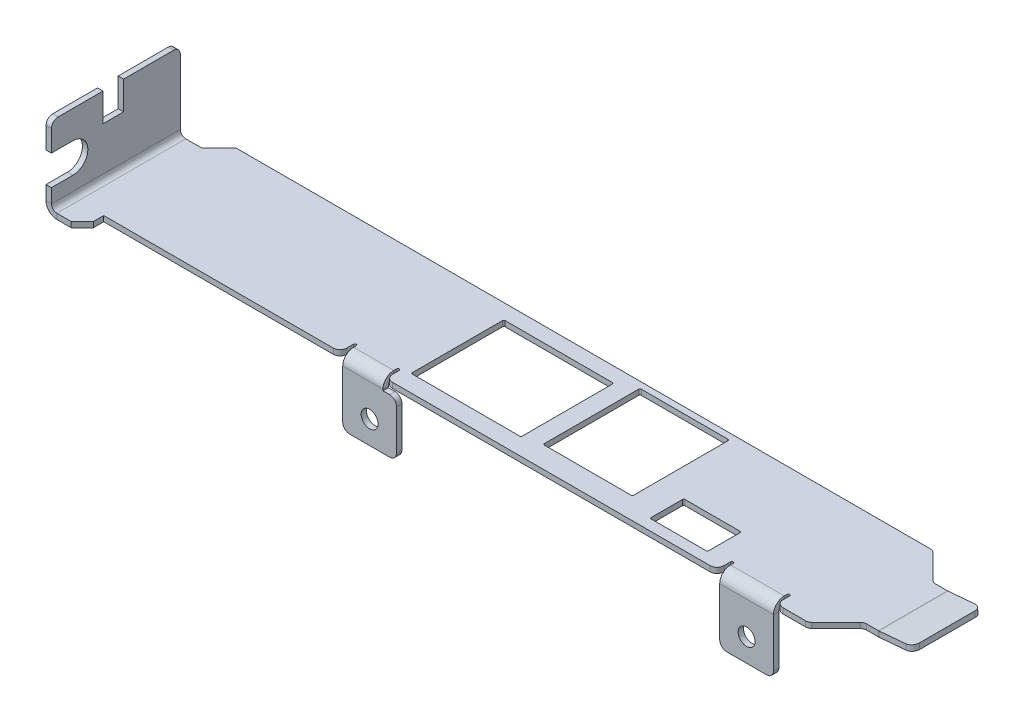
from build123d import *

# Parameters (mm, degrees)
SM_BASE_FLANGE_1_DEPTH           = 0.8
SKETCH_25_W                      = 16.240000001
SKETCH_25_H                      = 13.699999542
SKETCH_25_W_2                    = 13.2
SKETCH_25_H_2                    = 14.319999239
SKETCH_25_W_3                    = 8.5
SKETCH_25_H_3                    = 5
CUT_EXTRUDE_1_DEPTH              = 62.484573675
SM_EDGE_FLANGE_1_STRIP_CUT_DEPTH = 10.2
SM_EDGE_FLANGE_1_DEPTH           = 10.2
SM_START                         = -0.8
SM_EDGE_FLANGE_2_DEPTH           = 2.8
SM_START_2                       = 0.715504
SM_EDGE_FLANGE_2_2_OUTLINE_W     = 7.94
SM_EDGE_FLANGE_2_2_OUTLINE_H     = 0.8
SM_EDGE_FLANGE_2_2_DEPTH         = 1.284496
SM_START_3                       = -4.3519999
SM_EDGE_FLANGE_2_3_OUTLINE_W     = 7.94
SM_EDGE_FLANGE_2_3_OUTLINE_H     = 0.8
SM_EDGE_FLANGE_2_3_DEPTH         = 3.5519999
SM_START_4                       = -9
SM_EDGE_FLANGE_2_4_OUTLINE_W     = 7.94
SM_EDGE_FLANGE_2_4_OUTLINE_H     = 0.8
SM_EDGE_FLANGE_2_4_DEPTH         = 2.1479999
SM_START_5                       = 40.85
SM_EDGE_FLANGE_2_5_DEPTH         = 7.94
SM_EDGE_FLANGE_2_6_OUTLINE_W     = 2.5000002
SM_EDGE_FLANGE_2_6_OUTLINE_H     = 0.8
SM_EDGE_FLANGE_2_6_DEPTH         = 2.7199999
SM_START_6                       = 46.0700001
SM_EDGE_FLANGE_2_7_OUTLINE_W     = 2.5000002
SM_EDGE_FLANGE_2_7_OUTLINE_H     = 0.8
SM_EDGE_FLANGE_2_7_DEPTH         = 2.7199999
SM_START_7                       = 41.6657556
SM_EDGE_FLANGE_2_8_DEPTH         = 6.2856216
SM_START_8                       = 8.41
SM_EDGE_FLANGE_2_9_DEPTH         = 0.8
SM_START_9                       = -14.854
SM_EDGE_FLANGE_3_OUTLINE_W       = 8
SM_EDGE_FLANGE_3_OUTLINE_H       = 0.8
SM_EDGE_FLANGE_3_DEPTH           = 2.7199999
SM_START_10                      = -9.6339999
SM_EDGE_FLANGE_3_2_OUTLINE_W     = 8
SM_EDGE_FLANGE_3_2_OUTLINE_H     = 0.8
SM_EDGE_FLANGE_3_2_DEPTH         = 2.7199999
SM_START_11                      = -15.254
SM_EDGE_FLANGE_3_3_DEPTH         = 6.74
SM_EDGE_FLANGE_3_4_DEPTH         = 5.94
SM_EDGE_FLANGE_3_5_DEPTH         = 0.8
SM_START_12                      = -1
SM_EDGE_FLANGE_3_6_DEPTH         = 3
SM_EDGE_FLANGE_4_DEPTH           = 19.05
SM_START_13                      = 0.8
SM_EDGE_FLANGE_4_FLAT_DEPTH      = 0.8
FILLET_1_R                       = 1
FILLET_2_R                       = 0.2


with BuildPart() as part:
    # Базовая кромка1: sheet metal written as solids
    # Sketch 1 → Базовая кромка1 (new body)
    with BuildSketch(Plane(origin=(0, 0, 0), x_dir=(1, 0, 0), z_dir=(0, 1, 0))):
        Polygon((53.93, 9.21), (58.04, 5.1), (60.22, 5.1), (60.22, -5.1), (58.04, -5.1), (53.93, -9.21), (-50.17, -9.21), (-50.17, -10.74), (-51.81, -12.38), (-53.93, -12.38), (-53.93, 6.67), (-51.59, 6.67), (-49.05, 9.21), align=None)
    extrude(amount=SM_BASE_FLANGE_1_DEPTH)

    # Эскиз25 → Вырез-Вытянуть1 (cut, through all)
    with BuildSketch(Plane(origin=(0, 0.8, 0), x_dir=(1, 0, 0), z_dir=(0, 1, 0))):
        with Locations((0.854992541, 0.151324571)):
            Rectangle(SKETCH_25_W, SKETCH_25_H)
        with Locations((18.170071277, 1.126324154)):
            Rectangle(SKETCH_25_W_2, SKETCH_25_H_2)
        with Locations((33.169994901, -5.0986752)):
            Rectangle(SKETCH_25_W_3, SKETCH_25_H_3)
    extrude(amount=-CUT_EXTRUDE_1_DEPTH, mode=Mode.SUBTRACT)

    # Ребро-кромка1: sheet metal written as solids
    # Ребро-кромка1 strip (on a plane across the edge) → Ребро-кромка1 strip cut (cut)
    with BuildSketch(Plane(origin=(60.22, 0.8, 5.1), x_dir=(-0.08715574274765156, 0.9961946980917461, 0), z_dir=(0, 0, -1))):
        Polygon((-1.212259082, 4.677214117), (-0.793911517, -0.104520434), (0.003044242, -0.03479584), (-0.415303324, 4.746938711), align=None)
    extrude(amount=SM_EDGE_FLANGE_1_STRIP_CUT_DEPTH, mode=Mode.SUBTRACT)

    # Ребро-кромка1 section (on a plane across the edge) → Ребро-кромка1 (add)
    with BuildSketch(Plane(origin=(60.22, 0.8, 5.1), x_dir=(-0.08715574274765156, 0.9961946980917461, 0), z_dir=(0, 0, -1))):
        with BuildLine():
            Line((-0.8, 0.034928754), (-0.8, 5.019641982))
            Line((-0.8, 5.019641982), (0, 5.019641982))
            Line((0, 5.019641982), (0, 0.034928754))
            ThreePointArc((0, 0.034928754), (0.000761423, 3.3244e-05), (0.003044242, -0.03479584))
            Line((0.003044242, -0.03479584), (-0.793911517, -0.104520434))
            ThreePointArc((-0.793911517, -0.104520434), (-0.798477155, -0.034862265), (-0.8, 0.034928754))
        make_face()
    extrude(amount=SM_EDGE_FLANGE_1_DEPTH)

    # Ребро-кромка2: read off the stored shape, not the designer's step
    # Ребро-кромка2 outline → Ребро-кромка2 (cut)
    with BuildSketch(Plane(origin=(0, 0, 0), x_dir=(1, 0, 0), z_dir=(0, 1, 0)).offset(SM_START)):
        with BuildLine():
            Line((48.79, -7.21), (48.79, -9.21))
            Line((48.79, -9.21), (49.19, -9.21))
            Line((49.19, -9.21), (49.19, -7.21))
            ThreePointArc((49.19, -7.21), (48.99, -7.01), (48.79, -7.21))
        make_face()
        with BuildLine():
            Line((40.45, -9.21), (40.85, -9.21))
            Line((40.85, -9.21), (40.85, -7.21))
            ThreePointArc((40.85, -7.21), (40.65, -7.01), (40.45, -7.21))
            Line((40.45, -7.21), (40.45, -9.21))
        make_face()
    extrude(amount=SM_EDGE_FLANGE_2_DEPTH, mode=Mode.SUBTRACT)

    # Sm Edge Flange 2 2 outline → Sm Edge Flange 2 2 (cut)
    with BuildSketch(Plane(origin=(0, 0, 0), x_dir=(1, 0, 0), z_dir=(0, 1, 0)).offset(SM_START_2)):
        with Locations((44.82, -8.81)):
            Rectangle(SM_EDGE_FLANGE_2_2_OUTLINE_W, SM_EDGE_FLANGE_2_2_OUTLINE_H)
    extrude(amount=SM_EDGE_FLANGE_2_2_DEPTH, mode=Mode.SUBTRACT)

    # Sm Edge Flange 2 5 outline → Sm Edge Flange 2 5 (cut)
    with BuildSketch(Plane.YZ.offset(SM_START_5)):
        with BuildLine():
            Line((0, 9.21), (0, 8.995640646))
            ThreePointArc((0, 8.995640646), (0.585640646, 8.41), (0.8, 7.61))
            Line((0.8, 7.61), (0.8, 8.41))
            Line((0.8, 8.41), (0.715504, 8.41))
            Line((0.715504, 8.41), (0.715504, 9.21))
            Line((0.715504, 9.21), (0, 9.21))
        make_face()
    extrude(amount=SM_EDGE_FLANGE_2_5_DEPTH, mode=Mode.SUBTRACT)



with BuildPart() as body_2:
    # Sm Edge Flange 2 3 outline → Sm Edge Flange 2 3 (new body)
    with BuildSketch(Plane(origin=(0, 0, 0), x_dir=(1, 0, 0), z_dir=(0, 1, 0)).offset(SM_START_3)):
        with Locations((44.82, -8.81)):
            Rectangle(SM_EDGE_FLANGE_2_3_OUTLINE_W, SM_EDGE_FLANGE_2_3_OUTLINE_H)
    extrude(amount=SM_EDGE_FLANGE_2_3_DEPTH)


with BuildPart() as body_3:
    # Sm Edge Flange 2 4 outline → Sm Edge Flange 2 4 (new body)
    with BuildSketch(Plane(origin=(0, 0, 0), x_dir=(1, 0, 0), z_dir=(0, 1, 0)).offset(SM_START_4)):
        with Locations((44.82, -8.81)):
            Rectangle(SM_EDGE_FLANGE_2_4_OUTLINE_W, SM_EDGE_FLANGE_2_4_OUTLINE_H)
    extrude(amount=SM_EDGE_FLANGE_2_4_DEPTH)


with BuildPart() as part_1:
    add(part.part)

    add(body_2.part)  # Sm Edge Flange 2 6 merges body 2

    add(body_3.part)  # Sm Edge Flange 2 6 merges body 3
    # Sm Edge Flange 2 6 outline → Sm Edge Flange 2 6 (add)
    with BuildSketch(Plane.YZ.offset(SM_START_5)):
        with Locations((-5.602, 8.81)):
            Rectangle(SM_EDGE_FLANGE_2_6_OUTLINE_W, SM_EDGE_FLANGE_2_6_OUTLINE_H)
        with BuildLine():
            ThreePointArc((0, 8.995640646), (-0.385889528, 9.155481322), (-0.8, 9.21))
            Line((-0.8, 9.21), (-0.8, 8.41))
            ThreePointArc((-0.8, 8.41), (-0.234314575, 8.175685425), (0, 7.61))
            Line((0, 7.61), (0, 8.995640646))
        make_face()
    extrude(amount=SM_EDGE_FLANGE_2_6_DEPTH)

    # Sm Edge Flange 2 7 outline → Sm Edge Flange 2 7 (add)
    with BuildSketch(Plane.YZ.offset(SM_START_6)):
        with Locations((-5.602, 8.81)):
            Rectangle(SM_EDGE_FLANGE_2_7_OUTLINE_W, SM_EDGE_FLANGE_2_7_OUTLINE_H)
        with BuildLine():
            ThreePointArc((0, 8.995640646), (-0.385889528, 9.155481322), (-0.8, 9.21))
            Line((-0.8, 9.21), (-0.8, 8.41))
            ThreePointArc((-0.8, 8.41), (-0.234314575, 8.175685425), (0, 7.61))
            Line((0, 7.61), (0, 8.995640646))
        make_face()
    extrude(amount=SM_EDGE_FLANGE_2_7_DEPTH)

    # Sm Edge Flange 2 8 outline → Sm Edge Flange 2 8 (add)
    with BuildSketch(Plane.YZ.offset(SM_START_7)):
        with BuildLine():
            ThreePointArc((0, 8.995640646), (-0.385889528, 9.155481322), (-0.8, 9.21))
            Line((-0.8, 9.21), (-0.8, 8.41))
            ThreePointArc((-0.8, 8.41), (-0.234314575, 8.175685425), (0, 7.61))
            Line((0, 7.61), (0, 8.995640646))
        make_face()
    extrude(amount=SM_EDGE_FLANGE_2_8_DEPTH)

    # Sm Edge Flange 2 9 outline → Sm Edge Flange 2 9 (add)
    with BuildSketch(Plane.XY.offset(SM_START_8)):
        with BuildLine():
            Line((46.0700001, -6.8520001), (46.07, -5.602))
            ThreePointArc((46.07, -5.602), (45.703883476, -6.485883476), (44.82, -6.852))
            Line((44.82, -6.852), (46.0700001, -6.8520001))
        make_face()
        with BuildLine():
            ThreePointArc((44.82, -4.352), (45.703883476, -4.718116524), (46.07, -5.602))
            Line((46.07, -5.602), (46.0700001, -4.3519999))
            Line((46.0700001, -4.3519999), (44.82, -4.352))
        make_face()
        with BuildLine():
            ThreePointArc((43.57, -5.602), (43.936116524, -4.718116524), (44.82, -4.352))
            Line((44.82, -4.352), (43.5699999, -4.3519999))
            Line((43.5699999, -4.3519999), (43.57, -5.602))
        make_face()
        with BuildLine():
            Line((43.5699999, -6.8520001), (44.82, -6.852))
            ThreePointArc((44.82, -6.852), (43.936116524, -6.485883476), (43.57, -5.602))
            Line((43.57, -5.602), (43.5699999, -6.8520001))
        make_face()
    extrude(amount=SM_EDGE_FLANGE_2_9_DEPTH)

    # Sm Edge Flange 3 3 outline → Sm Edge Flange 3 3 (cut)
    with BuildSketch(Plane.YZ.offset(SM_START_11)):
        with BuildLine():
            Line((0, 9.21), (0, 8.995640646))
            ThreePointArc((0, 8.995640646), (0.585640646, 8.41), (0.8, 7.61))
            Line((0.8, 7.61), (0.8, 9.21))
            Line((0.8, 9.21), (0, 9.21))
        make_face()
    extrude(amount=SM_EDGE_FLANGE_3_3_DEPTH, mode=Mode.SUBTRACT)



with BuildPart() as body_2_2:
    # Ребро-кромка3: read off the stored shape, not the designer's step
    # Ребро-кромка3 outline → Ребро-кромка3 (new body)
    with BuildSketch(Plane.YZ.offset(SM_START_9)):
        with Locations((-5, 8.81)):
            Rectangle(SM_EDGE_FLANGE_3_OUTLINE_W, SM_EDGE_FLANGE_3_OUTLINE_H)
    extrude(amount=SM_EDGE_FLANGE_3_DEPTH)


with BuildPart() as body_3_2:
    # Sm Edge Flange 3 2 outline → Sm Edge Flange 3 2 (new body)
    with BuildSketch(Plane.YZ.offset(SM_START_10)):
        with Locations((-5, 8.81)):
            Rectangle(SM_EDGE_FLANGE_3_2_OUTLINE_W, SM_EDGE_FLANGE_3_2_OUTLINE_H)
    extrude(amount=SM_EDGE_FLANGE_3_2_DEPTH)


with BuildPart() as part_2:
    add(part_1.part)

    add(body_2_2.part)  # Sm Edge Flange 3 4 merges body 2 2

    add(body_3_2.part)  # Sm Edge Flange 3 4 merges body 3 2
    # Sm Edge Flange 3 4 outline → Sm Edge Flange 3 4 (add)
    with BuildSketch(Plane.YZ.offset(SM_START_9)):
        with BuildLine():
            Line((-0.8, 9.21), (-1, 9.21))
            Line((-1, 9.21), (-1, 8.41))
            Line((-1, 8.41), (-0.8, 8.41))
            ThreePointArc((-0.8, 8.41), (-0.234314575, 8.175685425), (0, 7.61))
            Line((0, 7.61), (0, 8.995640646))
            ThreePointArc((0, 8.995640646), (-0.385889528, 9.155481322), (-0.8, 9.21))
        make_face()
    extrude(amount=SM_EDGE_FLANGE_3_4_DEPTH)

    # Sm Edge Flange 3 5 outline → Sm Edge Flange 3 5 (add)
    with BuildSketch(Plane.XY.offset(SM_START_8)):
        with BuildLine():
            Line((-9.6339999, -9), (-9.634, -5.602))
            ThreePointArc((-9.634, -5.602), (-10.884, -6.852), (-12.134, -5.602))
            Line((-12.134, -5.602), (-12.1340001, -9))
            Line((-12.1340001, -9), (-9.6339999, -9))
        make_face()
        with BuildLine():
            ThreePointArc((-12.134, -5.602), (-10.884, -4.352), (-9.634, -5.602))
            Line((-9.634, -5.602), (-9.6339999, -1))
            Line((-9.6339999, -1), (-12.1340001, -1))
            Line((-12.1340001, -1), (-12.134, -5.602))
        make_face()
    extrude(amount=SM_EDGE_FLANGE_3_5_DEPTH)

    # Sm Edge Flange 3 6 outline → Sm Edge Flange 3 6 (cut)
    with BuildSketch(Plane(origin=(0, 0, 0), x_dir=(1, 0, 0), z_dir=(0, 1, 0)).offset(SM_START_12)):
        with BuildLine():
            Line((-14.854, -9), (-14.854, -7.21))
            ThreePointArc((-14.854, -7.21), (-15.054, -7.01), (-15.254, -7.21))
            Line((-15.254, -7.21), (-15.254, -9))
            Line((-15.254, -9), (-14.854, -9))
        make_face()
        with BuildLine():
            Line((-8.914, -7.21), (-8.914, -9))
            Line((-8.914, -9), (-8.514, -9))
            Line((-8.514, -9), (-8.514, -7.21))
            ThreePointArc((-8.514, -7.21), (-8.714, -7.01), (-8.914, -7.21))
        make_face()
    extrude(amount=SM_EDGE_FLANGE_3_6_DEPTH, mode=Mode.SUBTRACT)

    # Ребро-кромка4: sheet metal written as solids
    # Ребро-кромка4 bend section (on a plane across the edge) → Ребро-кромка4 (add)
    with BuildSketch(Plane(origin=(-54.73, 0.8, -6.67), x_dir=(1, 0, 0), z_dir=(0, 0, 1))):
        with BuildLine():
            Line((-0.8, 0.8), (0, 0.8))
            ThreePointArc((0, 0.8), (0.234314575, 0.234314575), (0.8, 0))
            Line((0.8, 0), (0.8, -0.8))
            ThreePointArc((0.8, -0.8), (-0.33137085, -0.33137085), (-0.8, 0.8))
        make_face()
    extrude(amount=SM_EDGE_FLANGE_4_DEPTH)

    # Ребро-кромка4 profile (on flange) → Ребро-кромка4 flat (add)
    with BuildSketch(Plane(origin=(-54.73, 0.8, 0), x_dir=(0, 0, 1), z_dir=(-1, 0, 0)).offset(SM_START_13)):
        with BuildLine():
            Line((-6.67, 11.43), (-6.67, 0.8))
            Line((-6.67, 0.8), (12.38, 0.8))
            Line((12.38, 0.8), (12.38, 2.87))
            Line((12.38, 2.87), (9.21, 2.87))
            ThreePointArc((9.21, 2.87), (7, 5.08), (9.21, 7.29))
            Line((9.21, 7.29), (12.38, 7.29))
            Line((12.38, 7.29), (12.38, 11.43))
            Line((12.38, 11.43), (4.76, 11.43))
            Line((4.76, 11.43), (4.76, 7.24))
            Line((4.76, 7.24), (1.71, 7.24))
            Line((1.71, 7.24), (1.71, 11.43))
            Line((1.71, 11.43), (-6.67, 11.43))
        make_face()
    extrude(amount=-SM_EDGE_FLANGE_4_FLAT_DEPTH)

    # Скругление1
    fillet_1_edges = [part_2.edges().sort_by_distance(p)[0] for p in [
        (65.255403026, 0.839012746, 5.1),
        (65.255403026, 0.839012746, -5.1),
        (40.45, 0.4, 9.21),
        (49.19, 0.4, 9.21),
        (48.79, -9, 8.81),
        (40.85, -9, 8.81),
        (-15.254, 0.4, 9.21),
        (-8.514, 0.4, 9.21),
        (-14.854, -9, 8.81),
        (-6.914, -9, 8.81),
        (-6.914, -1, 8.81),
        (53.93, 0.4, -9.21),
        (58.04, 0.4, -5.1),
        (58.04, 0.4, 5.1),
        (53.93, 0.4, 9.21),
        (-55.13, 12.23, -6.67),
        (-55.13, 12.23, 12.38),
    ]]
    fillet(fillet_1_edges, radius=FILLET_1_R)

    # Скругление2
    fillet_2_edges = [part_2.edges().sort_by_distance(p)[0] for p in [
        (-7.26500746, 0.4, 6.6986752),
        (-7.26500746, 0.4, -7.001324342),
        (8.974992541, 0.4, -7.001324342),
        (8.974992541, 0.4, 6.6986752),
        (11.570071277, 0.4, 6.033675466),
        (11.570071277, 0.4, -8.286323773),
        (24.770071277, 0.4, -8.286323773),
        (24.770071277, 0.4, 6.033675466),
        (37.419994901, 0.4, 2.5986752),
        (37.419994901, 0.4, 7.5986752),
        (28.919994901, 0.4, 7.5986752),
        (28.919994901, 0.4, 2.5986752),
    ]]
    fillet(fillet_2_edges, radius=FILLET_2_R)


solid = part_2.part
